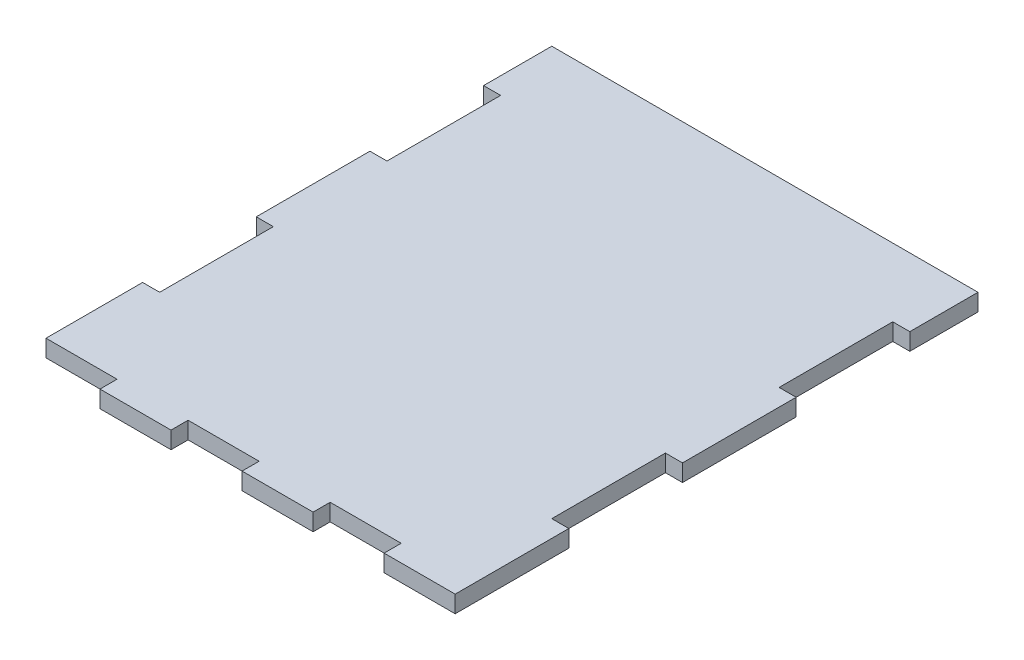
from build123d import *

# Parameters (mm, degrees)
SKETCH1_W           = 150
SKETCH1_H           = 184
BOSS_EXTRUDE1_DEPTH = 6
SKETCH2_W           = 6
SKETCH2_H           = 40
CUT_EXTRUDE1_DEPTH  = 6
SKETCH11_W          = 25
SKETCH11_H          = 6
CUT_EXTRUDE10_DEPTH = 6


with BuildPart() as part:
    # Sketch1 → Boss-Extrude1 (new body)
    with BuildSketch(Plane(origin=(0, 0, 0), x_dir=(1, 0, 0), z_dir=(0, 1, 0))):
        Rectangle(SKETCH1_W, SKETCH1_H)
    extrude(amount=BOSS_EXTRUDE1_DEPTH)

    # Sketch2 → Cut-Extrude1 (cut)
    with BuildSketch(Plane(origin=(0, 6, 0), x_dir=(1, 0, 0), z_dir=(0, 1, 0))):
        with Locations((-72, 48)):
            Rectangle(SKETCH2_W, SKETCH2_H)
        with Locations((72, 48)):
            Rectangle(SKETCH2_W, SKETCH2_H)
        with Locations((72, -32)):
            Rectangle(SKETCH2_W, SKETCH2_H)
        with Locations((-72, -32)):
            Rectangle(SKETCH2_W, SKETCH2_H)
    extrude(amount=-CUT_EXTRUDE1_DEPTH, mode=Mode.SUBTRACT)

    # Sketch11 → Cut-Extrude10 (cut)
    with BuildSketch(Plane(origin=(0, 6, 0), x_dir=(1, 0, 0), z_dir=(0, 1, 0))):
        with Locations((-12.5, -89)):
            Rectangle(SKETCH11_W, SKETCH11_H)
        with Locations((-62.5, -89)):
            Rectangle(SKETCH11_W, SKETCH11_H)
        with Locations((37.5, -89)):
            Rectangle(SKETCH11_W, SKETCH11_H)
    extrude(amount=-CUT_EXTRUDE10_DEPTH, mode=Mode.SUBTRACT)


solid = part.part
